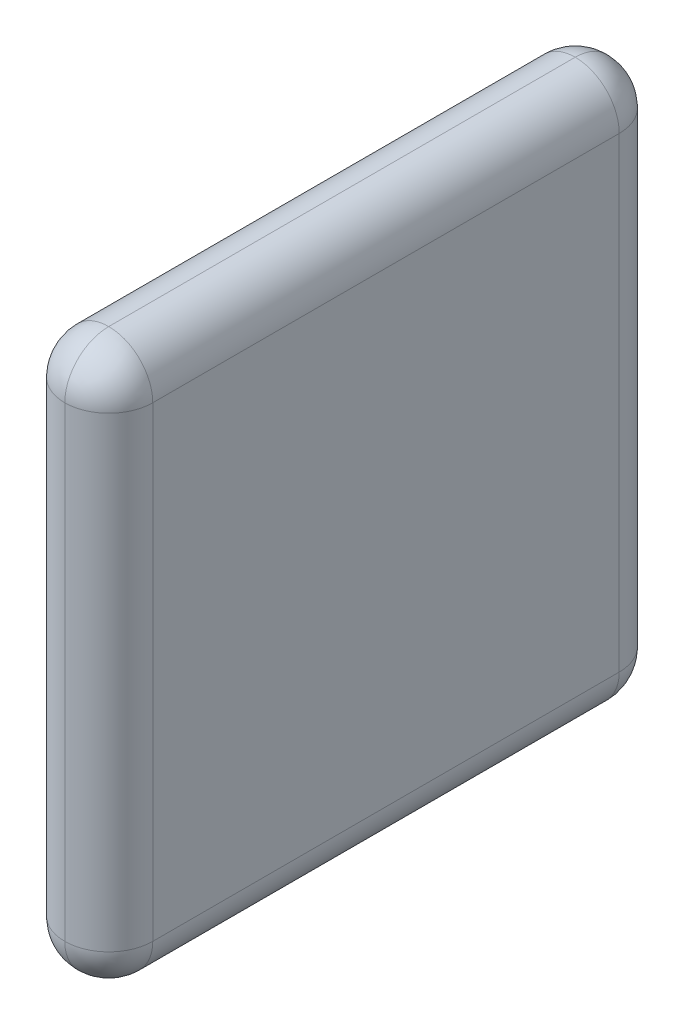
from build123d import *

# Parameters (mm, degrees)
SKETCH1_W           = 6.3
SKETCH1_H           = 6.3
BOSS_EXTRUDE1_DEPTH = 1
FILLET1_R           = 0.5


with BuildPart() as part:
    # Sketch1 → Boss-Extrude1 (new body)
    with BuildSketch(Plane(origin=(0, 0, 0), x_dir=(0, 0, -1), z_dir=(1, 0, 0))):
        Rectangle(SKETCH1_W, SKETCH1_H)
    extrude(amount=BOSS_EXTRUDE1_DEPTH)

    # Fillet1
    fillet1_edges = [part.edges().sort_by_distance(p)[0] for p in [
        (1, 0, 3.15),
        (1, -3.15, 0),
        (1, 0, -3.15),
        (0, -3.15, 0),
        (0, 0, 3.15),
        (0, 3.15, 0),
        (0, 0, -3.15),
        (0.5, -3.15, -3.15),
        (0.5, -3.15, 3.15),
        (0.5, 3.15, 3.15),
        (0.5, 3.15, -3.15),
        (1, 3.15, 0),
    ]]
    fillet(fillet1_edges, radius=FILLET1_R - 0.0001)  # a hair under: the kernel refuses the full size


solid = part.part
